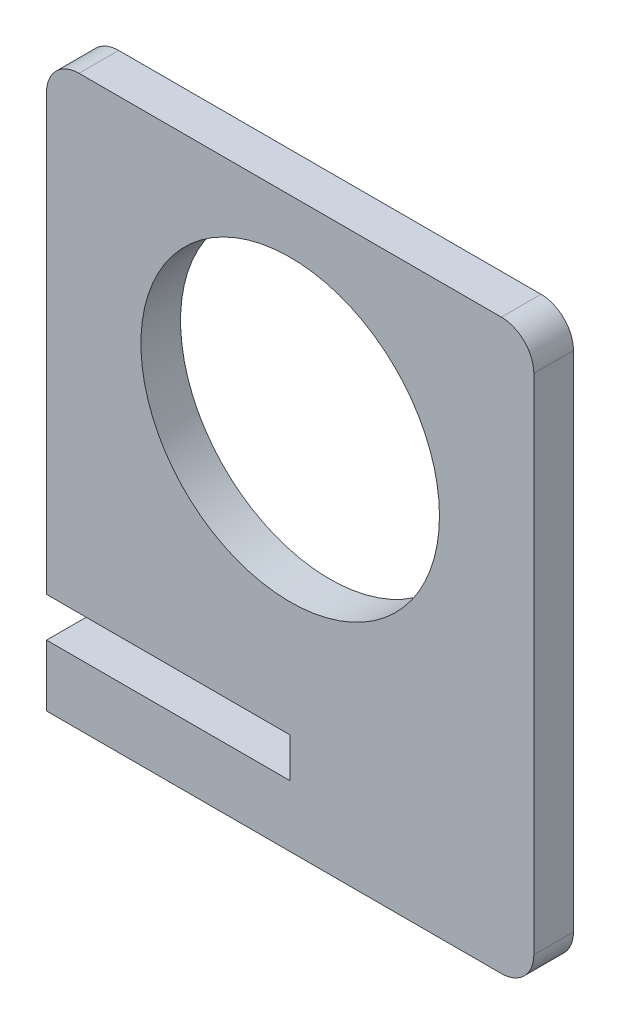
from build123d import *

# Parameters (mm, degrees)
SKETCH1_R           = 11.6713
BOSS_EXTRUDE1_DEPTH = 1.5494
FILLET1_R           = 2.54


with BuildPart() as part:
    # Sketch1 → Boss-Extrude1 (new, symmetric)
    with BuildSketch(Plane.XY):
        Polygon((-19.05, 1.5494), (0, 1.5494), (0, -1.5494), (-19.05, -1.5494), (-19.05, -6.35), (19.05, -6.35), (19.05, 38.1), (-19.05, 38.1), align=None)
        with Locations((0, 22.225)):
            Circle(SKETCH1_R, mode=Mode.SUBTRACT)
    extrude(amount=BOSS_EXTRUDE1_DEPTH, both=True)

    # Fillet1
    fillet1_edges = [part.edges().sort_by_distance(p)[0] for p in [
        (19.05, -6.35, 0),
        (-19.05, 38.1, 0),
        (19.05, 38.1, 0),
    ]]
    fillet(fillet1_edges, radius=FILLET1_R)


solid = part.part
